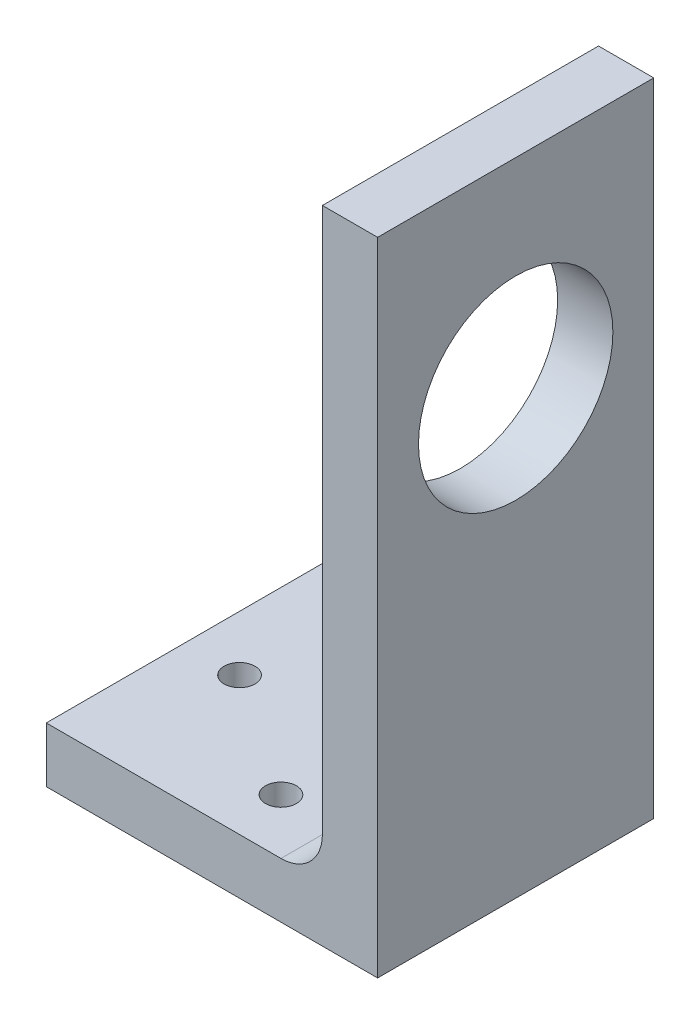
from build123d import *

# Parameters (mm, degrees)
SKETCH3_W           = 31.75
SKETCH3_H           = 67.404000066
SKETCH3_R           = 11.176
BOSS_EXTRUDE1_DEPTH = 6.35
SKETCH5_W           = 31.75
SKETCH5_H           = 6.35
BOSS_EXTRUDE2_DEPTH = 38.1
FILLET1_R           = 4.7625
SKETCH6_R           = 1.777000002
CUT_EXTRUDE1_DEPTH  = 81.990272409


with BuildPart() as part:
    # Sketch3 → Boss-Extrude1 (new body)
    with BuildSketch(Plane(origin=(0, 0, 0), x_dir=(0, 0, -1), z_dir=(1, 0, 0))):
        with Locations((15.875, 33.702000033)):
            Rectangle(SKETCH3_W, SKETCH3_H)
        with Locations((15.875, 44.45)):
            Circle(SKETCH3_R, mode=Mode.SUBTRACT)
    extrude(amount=BOSS_EXTRUDE1_DEPTH)

    # Sketch5 → Boss-Extrude2 (add)
    with BuildSketch(Plane(origin=(6.35, 0, 0), x_dir=(0, 0, -1), z_dir=(1, 0, 0))):
        with Locations((15.875, -3.175)):
            Rectangle(SKETCH5_W, SKETCH5_H)
    extrude(amount=-BOSS_EXTRUDE2_DEPTH)

    # Fillet1
    fillet1_edges = [part.edges().sort_by_distance(p)[0] for p in [
        (0, 0, -15.875),
    ]]
    fillet(fillet1_edges, radius=FILLET1_R)

    # Sketch6 → Cut-Extrude1 (cut, through all)
    with BuildSketch(Plane(origin=(0, 0, 0), x_dir=(1, 0, 0), z_dir=(0, 1, 0))):
        with Locations((-11.1125, 6.35)):
            Circle(SKETCH6_R)
        with Locations((-25.4, 15.875)):
            Circle(SKETCH6_R)
        with Locations((-11.1125, 25.4)):
            Circle(SKETCH6_R)
    extrude(amount=-CUT_EXTRUDE1_DEPTH, mode=Mode.SUBTRACT)


solid = part.part
